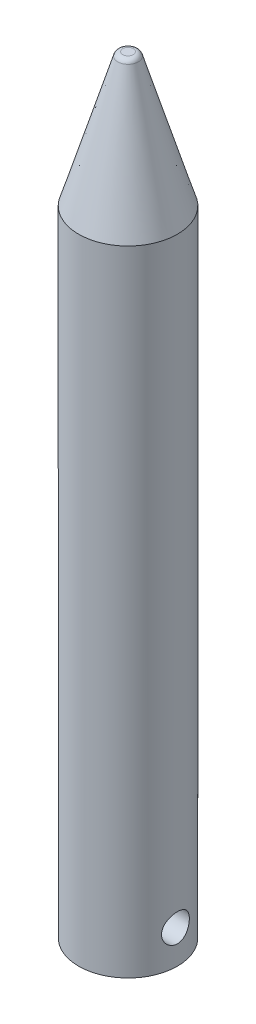
from build123d import *

# Parameters (mm, degrees)
SKETCH1_R           = 9.398
BOSS_EXTRUDE1_DEPTH = 120.65
SKETCH3_R           = 2.65
CUT_EXTRUDE1_DEPTH  = 30


with BuildPart() as part:
    # Sketch1 → Boss-Extrude1 (new body)
    with BuildSketch(Plane(origin=(0, 0, 0), x_dir=(1, 0, 0), z_dir=(0, 1, 0))):
        Circle(SKETCH1_R)
    extrude(amount=BOSS_EXTRUDE1_DEPTH)

    # Sketch2 → Revolve1 (revolve)
    with BuildSketch(Plane.XY):
        with BuildLine():
            Line((0, 120.65), (0, 146.05))
            Line((0, 146.05), (1, 146.05))
            ThreePointArc((1, 146.05), (1.59642422, 145.85266939), (1.95746293, 145.338556299))
            Line((1.95746293, 145.338556299), (9.398, 120.65))
            Line((9.398, 120.65), (0, 120.65))
        make_face()
    revolve(axis=Axis((0, 120.65, 0), (0, 1, 0)))

    # Sketch3 → Cut-Extrude1 (cut, symmetric)
    with BuildSketch(Plane(origin=(0, 0, 0), x_dir=(0, 0, -1), z_dir=(1, 0, 0))):
        with Locations((0, 6.35)):
            Circle(SKETCH3_R)
    extrude(amount=CUT_EXTRUDE1_DEPTH, both=True, mode=Mode.SUBTRACT)


solid = part.part
